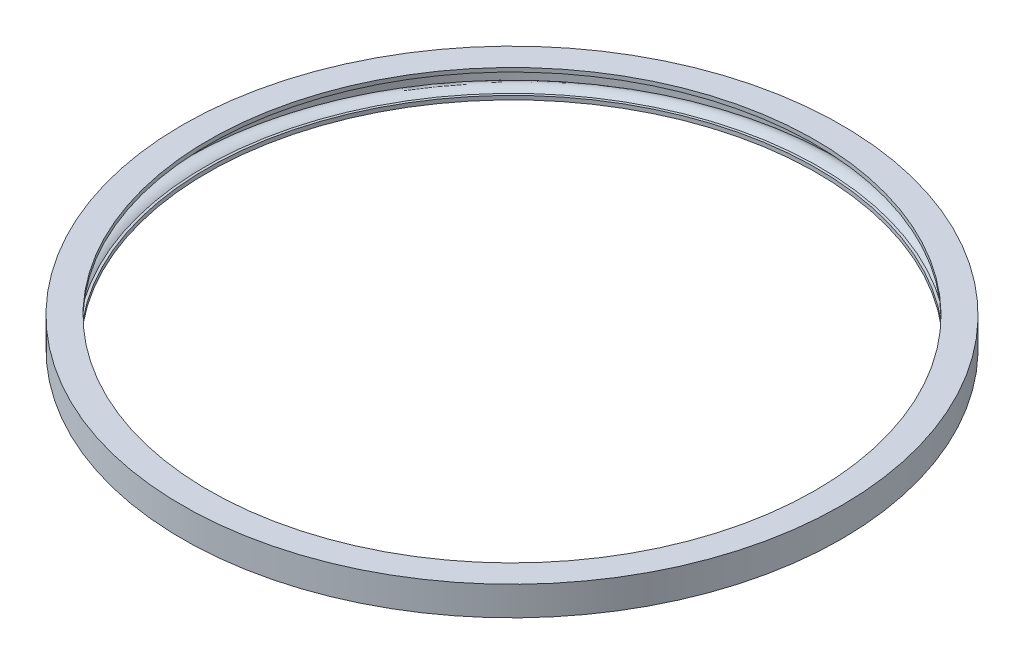
from build123d import *


with BuildPart() as part:
    # Sketch2 → Revolve1 (revolve)
    with BuildSketch(Plane(origin=(19.120852058, -450.556987891, 65.570618185), x_dir=(-0.9800835557204909, -4.980770021259261e-15, -0.1985855578995605), z_dir=(0.1985855578995605, 2.571409064264252e-15, -0.9800835557204909))):
        with BuildLine():
            ThreePointArc((-263.332584066, 5.221571347), (-258.227186422, 6.173270114), (-253.807584066, 8.900527101))
            Line((-253.807584066, 8.900527101), (-253.807584066, 7.161851411))
            Line((-253.807584066, 7.161851411), (-249.807584066, 7.161851411))
            Line((-249.807584066, 7.161851411), (-249.807584066, 11.221571347))
            Line((-249.807584066, 11.221571347), (-276.857584066, 11.221571347))
            Line((-276.857584066, 11.221571347), (-276.857584066, -18.820517146))
            Line((-276.857584066, -18.820517146), (-251.278247656, -18.820517146))
            Line((-251.278247656, -18.820517146), (-251.278247656, -14.76079721))
            Line((-251.278247656, -14.76079721), (-253.807584066, -14.76079721))
            Line((-253.807584066, -14.76079721), (-253.807584066, -16.499472899))
            ThreePointArc((-253.807584066, -16.499472899), (-258.227186422, -13.772215913), (-263.332584066, -12.820517146))
            ThreePointArc((-263.332584066, -12.820517146), (-268.437981711, -13.772215913), (-272.857584066, -16.499472899))
            Line((-272.857584066, -16.499472899), (-272.857584066, 8.900527101))
            ThreePointArc((-272.857584066, 8.900527101), (-268.437981711, 6.173270114), (-263.332584066, 5.221571347))
        make_face()
    revolve(axis=Axis((-43.303037423, -445.335416543, 52.922224233), (0, 1, 0)))


solid = part.part
